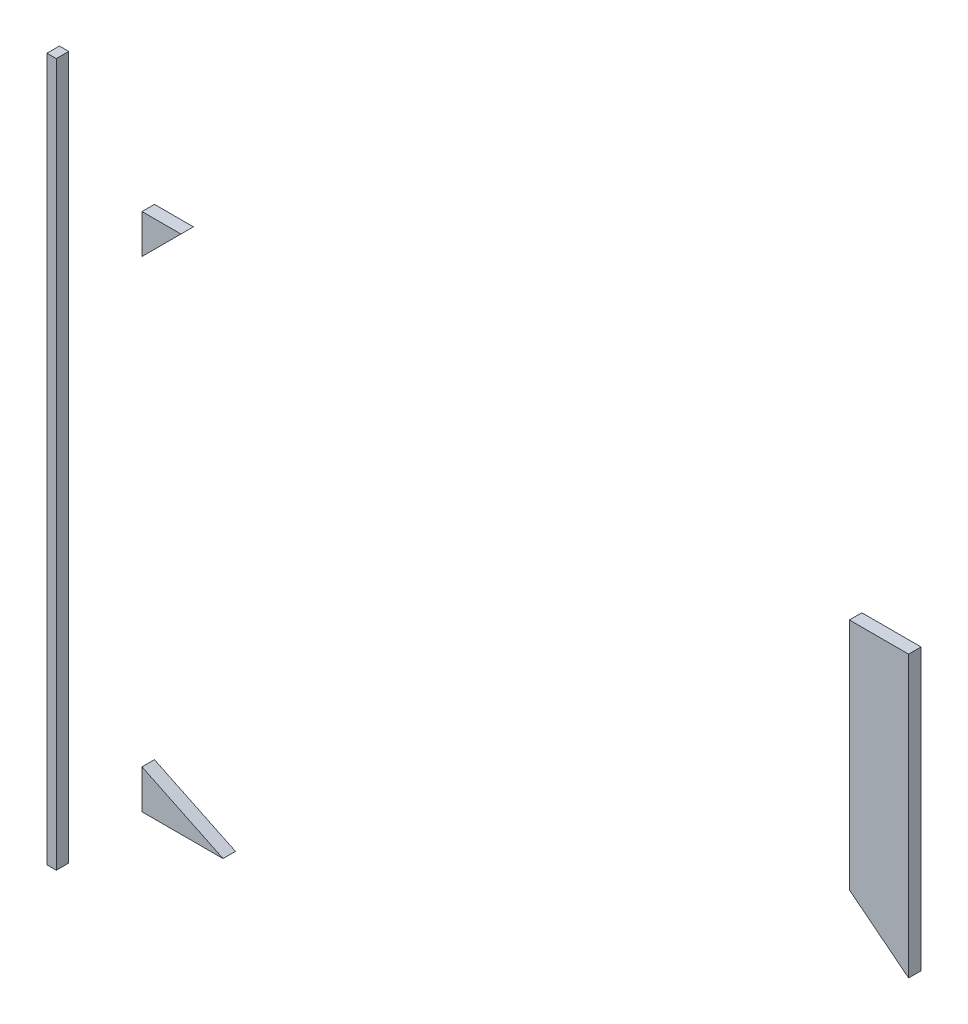
from build123d import *

# Parameters (mm, degrees)
BOSS_EXTRU_2_DEPTH   = 8
BOSS_EXTRU_2_2_DEPTH = 8
BOSS_EXTRU_2_3_DEPTH = 8
ESQUISSE8_W          = 6
ESQUISSE8_H          = 451.132327751
BOSS_EXTRU_3_DEPTH   = 8


with BuildPart() as part:
    # Esquisse5 → Boss.-Extru.2 (new body)
    with BuildSketch(Plane.XY.offset(8)):
        Polygon((-30.499999988, 39.509050242), (21.500000015, 14.509050242), (-30.499999985, 14.509050242), align=None)
    extrude(amount=-BOSS_EXTRU_2_DEPTH)


with BuildPart() as body_2:
    # Esquisse5 → Boss.-Extru.2 2 (new body)
    with BuildSketch(Plane.XY.offset(8)):
        Polygon((-30.499999988, 323.138361245), (-5.499999988, 348.138361245), (-30.499999988, 348.138361245), align=None)
    extrude(amount=-BOSS_EXTRU_2_2_DEPTH)


with BuildPart() as body_3:
    # Esquisse5 → Boss.-Extru.2 3 (new body)
    with BuildSketch(Plane.XY.offset(8)):
        Polygon((423.500000015, 348.138361245), (423.500000015, 198.138361245), (461.500000015, 168.138361245), (461.500000012, 348.138361245), align=None)
    extrude(amount=-BOSS_EXTRU_2_3_DEPTH)


with BuildPart() as body_4:
    # Esquisse8 → Boss.-Extru.3 (new body)
    with BuildSketch(Plane.XY.offset(8)):
        with Locations((-88.499999985, 180.075214118)):
            Rectangle(ESQUISSE8_W, ESQUISSE8_H)
    extrude(amount=-BOSS_EXTRU_3_DEPTH)


solid = Compound([part.part, body_2.part, body_3.part, body_4.part])
